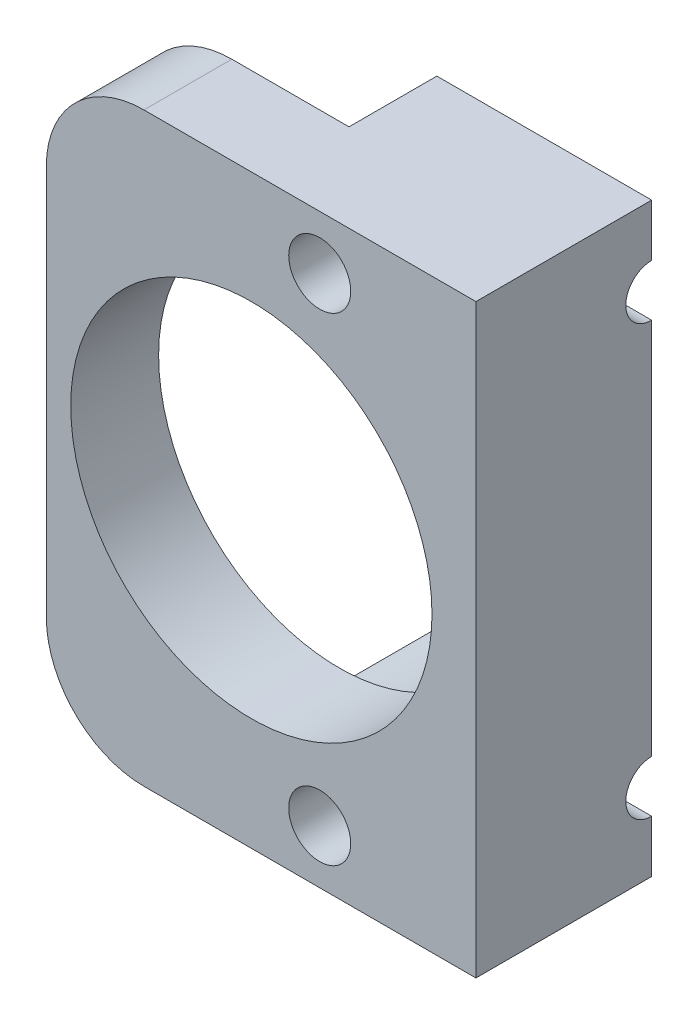
from build123d import *

# Parameters (mm, degrees)
SKETCH1_W                     = 44
SKETCH1_H                     = 60
SKETCH1_R                     = 18.5
BOSS_EXTRUDE1_DEPTH           = 4.5
BOSS_EXTRUDE2_DEPTH           = 9
FILLET1_R                     = 10
SKETCH5_R                     = 3.175
CUT_EXTRUDE1_DEPTH            = 42.868842831
CUT_EXTRUDE2_DEPTH            = 4.75
FILLET2_R                     = 1
SKETCH10_W                    = 2.65
SKETCH10_H                    = 6
M5_CLEARANCE_HOLE1_AT_2_COUNT = 2
M5_CLEARANCE_HOLE1_AT_2_PITCH = 44


with BuildPart() as part:
    # Sketch1 → Boss-Extrude1 (new, symmetric)
    with BuildSketch(Plane.XY):
        with Locations((1, 0)):
            Rectangle(SKETCH1_W, SKETCH1_H)
        Circle(SKETCH1_R, mode=Mode.SUBTRACT)
    extrude(amount=BOSS_EXTRUDE1_DEPTH, both=True)

    # Sketch3 → Boss-Extrude2 (add)
    with BuildSketch(Plane(origin=(0, 0, -4.5), x_dir=(-1, 0, 0), z_dir=(0, 0, -1))):
        with BuildLine():
            Line((-23, 30), (-1, 30))
            Line((-1, 30), (-1, 18.973665961))
            ThreePointArc((-1, 18.973665961), (-19, 0), (-1, -18.973665961))
            Line((-1, -18.973665961), (-1, -30))
            Line((-1, -30), (-23, -30))
            Line((-23, -30), (-23, 30))
        make_face()
    extrude(amount=BOSS_EXTRUDE2_DEPTH)

    # Fillet1
    fillet1_edges = [part.edges().sort_by_distance(p)[0] for p in [
        (-21, -30, 0),
        (-21, 30, 0),
    ]]
    fillet(fillet1_edges, radius=FILLET1_R)

    # Sketch5 → Cut-Extrude1 (cut, through all)
    with BuildSketch(Plane(origin=(0, 0, -13.5), x_dir=(-1, 0, 0), z_dir=(0, 0, -1))):
        with Locations((-7, 24.5)):
            Circle(SKETCH5_R)
        with Locations((-7, -24.5)):
            Circle(SKETCH5_R)
    extrude(amount=-CUT_EXTRUDE1_DEPTH, mode=Mode.SUBTRACT)

    # Sketch6 → Cut-Extrude2 (cut)
    with BuildSketch(Plane(origin=(0, 0, -13.5), x_dir=(-1, 0, 0), z_dir=(0, 0, -1))):
        with BuildLine():
            Line((-15.5, 18), (-13.5, 18))
            ThreePointArc((-13.5, 18), (-12, 18), (-12, 19.5))
            Line((-12, 19.5), (-12, 24.5))
            ThreePointArc((-12, 24.5), (-12, 26), (-13.5, 26))
            Line((-13.5, 26), (-15.5, 26))
            ThreePointArc((-15.5, 26), (-17, 26), (-17, 24.5))
            Line((-17, 24.5), (-17, 19.5))
            ThreePointArc((-17, 19.5), (-17, 18), (-15.5, 18))
        make_face()
        with BuildLine():
            Line((-15.5, -18), (-13.5, -18))
            ThreePointArc((-13.5, -18), (-12, -18), (-12, -19.5))
            Line((-12, -19.5), (-12, -24.5))
            ThreePointArc((-12, -24.5), (-12, -26), (-13.5, -26))
            Line((-13.5, -26), (-15.5, -26))
            ThreePointArc((-15.5, -26), (-17, -26), (-17, -24.5))
            Line((-17, -24.5), (-17, -19.5))
            ThreePointArc((-17, -19.5), (-17, -18), (-15.5, -18))
        make_face()
    extrude(amount=-CUT_EXTRUDE2_DEPTH, mode=Mode.SUBTRACT)

    # Fillet2
    fillet2_edges = [part.edges().sort_by_distance(p)[0] for p in [
        (17, -19.5, -11.125),
        (17, -24.5, -11.125),
        (15.5, -26, -11.125),
        (13.5, -26, -11.125),
        (12, -24.5, -11.125),
        (12, -19.5, -11.125),
        (13.5, -18, -11.125),
        (15.5, -18, -11.125),
        (17, 24.5, -11.125),
        (17, 19.5, -11.125),
        (15.5, 18, -11.125),
        (13.5, 18, -11.125),
        (12, 19.5, -11.125),
        (12, 24.5, -11.125),
        (13.5, 26, -11.125),
        (15.5, 26, -11.125),
    ]]
    fillet(fillet2_edges, radius=FILLET2_R)

    # Sketch10 → M5 Clearance Hole1 (revolve, cut)
    with BuildSketch(Plane(origin=(17, -22, -13.5), x_dir=(0, 0, 1), z_dir=(0, 1, 0))):
        with Locations((1.325, 3)):
            Rectangle(SKETCH10_W, SKETCH10_H)
    m5_clearance_hole1 = revolve(axis=Axis((10.65, -22, -13.5), (1, 0, 0)), mode=Mode.SUBTRACT)

    # M5 Clearance Hole1 at 2: M5 Clearance Hole1 ×2
    with Locations(*[(0, i * M5_CLEARANCE_HOLE1_AT_2_PITCH, 0) for i in range(1, M5_CLEARANCE_HOLE1_AT_2_COUNT)]):
        add(m5_clearance_hole1, mode=Mode.SUBTRACT)


solid = part.part
